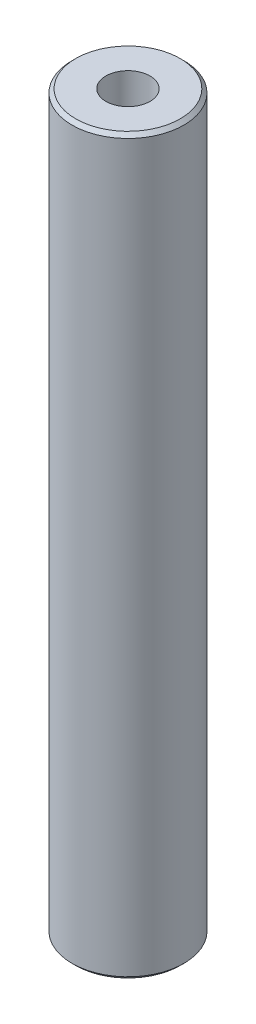
from build123d import *

# Parameters (mm, degrees)
SKETCH1_R           = 15
BOSS_EXTRUDE1_DEPTH = 196.776789764
SKETCH2_R           = 5.92507095
CUT_EXTRUDE1_DEPTH  = 198.916914361
CHAMFER1_SIZE       = 0.975081596


with BuildPart() as part:
    # Sketch1 → Boss-Extrude1 (new body)
    with BuildSketch(Plane(origin=(0, 0, 0), x_dir=(1, 0, 0), z_dir=(0, 1, 0))):
        Circle(SKETCH1_R)
    extrude(amount=BOSS_EXTRUDE1_DEPTH)

    # Sketch2 → Cut-Extrude1 (cut, through all)
    with BuildSketch(Plane(origin=(0, 0, 0), x_dir=(1, 0, 0), z_dir=(0, 1, 0))):
        Circle(SKETCH2_R)
    extrude(amount=CUT_EXTRUDE1_DEPTH, mode=Mode.SUBTRACT)

    # Chamfer1
    chamfer1_edges = [part.edges().sort_by_distance(p)[0] for p in [
        (-15, 196.776789764, 0),
        (-15, 0, 0),
    ]]
    chamfer(chamfer1_edges, length=CHAMFER1_SIZE)


solid = part.part
